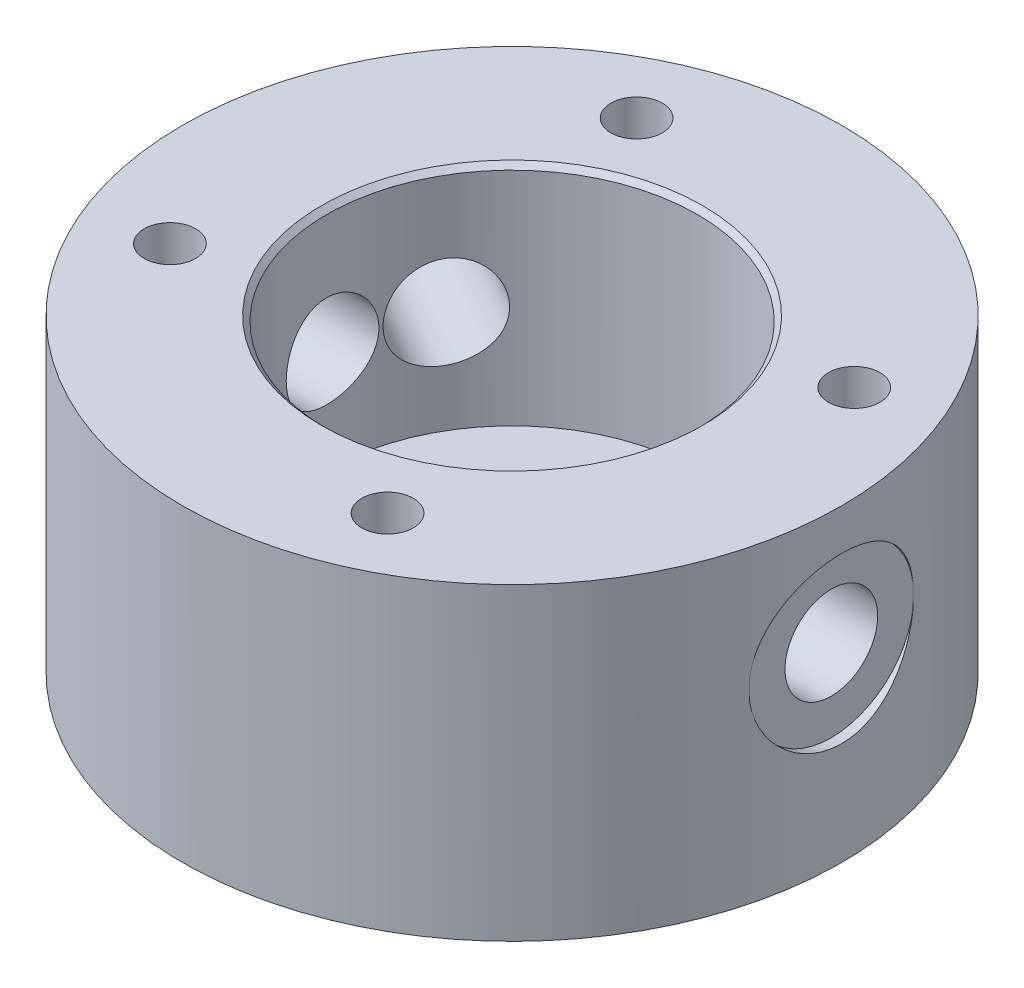
from build123d import *

# Parameters (mm, degrees)
ESBO_O4_W                        = 2.25
ESBO_O4_H                        = 16
F_4_5_4_5_DIAMETER_HOLE2_D       = 4.5
F_4_5_4_5_DIAMETER_HOLE2_DEPTH   = 18
F_4_5_4_5_DIAMETER_HOLE2_TIP     = 1.351936393
ESBO_O12_R                       = 16
ESBO_O12_R_2                     = 9
RESSALTO_EXTRUS_O1_DEPTH         = 1
CHANFRO1_SIZE                    = 0.5
CHANFRO2_SIZE                    = 0.25
FURO_DE_DI_METRO_4_5_4_5_2_D     = 4.5
FURO_DE_DI_METRO_4_5_4_5_2_DEPTH = 8
FURO_DE_DI_METRO_4_5_4_5_2_TIP   = 1.351936393
CORTE_EXTRUS_O4_START            = -0.5
ESBO_O18_R                       = 4
ESBO_O18_R_2                     = 2.25
CORTE_EXTRUS_O4_DEPTH            = 0.5
PADR_OCIRCULAR6_COUNT            = 2
PADR_OCIRCULAR6_ANGLE            = 30
PADR_OCIRCULAR7_COUNT            = 2
PADR_OCIRCULAR7_ANGLE            = 210


# Read off the part's stored shape, not the designer's step: PadrãoCircular5
with BuildPart() as part:
    # Esboço1 → Revolução1 (revolve)
    with BuildSketch(Plane.XY, mode=Mode.PRIVATE) as revolu_o1_sk:
        Polygon((3, -9), (16, -9), (16, 5), (9, 5), (9, -5), (3, -5), align=None)
    revolve(revolu_o1_sk.sketch.rotate(Axis((0, -9, 0), (0, 1, 0)), 90), axis=Axis((0, -9, 0), (0, 1, 0)))

    # Esboço4 → Furo de diâmetro Ø4.5 (4.5)1 (revolve, cut)
    with BuildSketch(Plane(origin=(16, 0, 0), x_dir=(0, 0, -1), z_dir=(0, 1, 0))):
        with Locations((1.125, 8)):
            Rectangle(ESBO_O4_W, ESBO_O4_H)
    revolve(axis=Axis((22.35, 0, 0), (-1, 0, 0)), mode=Mode.SUBTRACT)

    # Ø4.5 (4.5) Diameter Hole2
    with Locations(Plane(origin=(-13.856406461, 0, -8), x_dir=(0, -1, 0), z_dir=(-0.8660254037844364, 0, -0.5000000000000041))):
        with Locations((0, 0)):
            Hole(F_4_5_4_5_DIAMETER_HOLE2_D / 2, depth=F_4_5_4_5_DIAMETER_HOLE2_DEPTH)
            with Locations((0, 0, -(F_4_5_4_5_DIAMETER_HOLE2_DEPTH + F_4_5_4_5_DIAMETER_HOLE2_TIP / 2))):  # 118° drill point
                Cone(0, F_4_5_4_5_DIAMETER_HOLE2_D / 2, F_4_5_4_5_DIAMETER_HOLE2_TIP, mode=Mode.SUBTRACT)

    # Esboço12 → Ressalto-extrusão1 (add)
    with BuildSketch(Plane(origin=(0, 5, 0), x_dir=(1, 0, 0), z_dir=(0, 1, 0))):
        with Locations(Location((0, 0, 0), (0, 0, 90))):
            Circle(ESBO_O12_R)
        with Locations(Location((0, 0, 0), (0, 0, 90))):
            Circle(ESBO_O12_R_2, mode=Mode.SUBTRACT)
    extrude(amount=RESSALTO_EXTRUS_O1_DEPTH)

    # Esboço13 → Furo roscado de M3x0.51 (revolve, cut)
    with BuildSketch(Plane(origin=(11.328847338, 6, -5.282728272), x_dir=(0, 0, 1), z_dir=(1, 0, 0))):
        Polygon((0, 0), (0, 10.751075774), (1.25, 10), (1.25, 0), align=None)
    revolve(axis=Axis((11.328847338, 12.35, -5.282728272), (0, -1, 0)), mode=Mode.SUBTRACT)

    # PadrãoCircular5 outline → PadrãoCircular5 (revolve, cut)
    with BuildSketch(Plane(origin=(5.282728272, 0, 11.328847338), x_dir=(1, 0, 0), z_dir=(0, 0, 1))):
        Polygon((0, 6), (0, -4.751075774), (1.25, -4), (1.25, 6), align=None)
    revolve(axis=Axis((5.282728272, 0, 11.328847338), (0, 1, 0)), mode=Mode.SUBTRACT)

    # Padr_oCircular5 2 outline → Padr_oCircular5 2 (revolve, cut)
    with BuildSketch(Plane(origin=(-11.328847338, 0, 5.282728272), x_dir=(1, 0, 0), z_dir=(0, 0, 1))):
        Polygon((0, 6), (0, -4.751075774), (1.25, -4), (1.25, 6), align=None)
    revolve(axis=Axis((-11.328847338, 0, 5.282728272), (0, 1, 0)), mode=Mode.SUBTRACT)

    # Padr_oCircular5 3 outline → Padr_oCircular5 3 (revolve, cut)
    with BuildSketch(Plane(origin=(-5.282728272, 0, -11.328847338), x_dir=(1, 0, 0), z_dir=(0, 0, 1))):
        Polygon((0, 6), (0, -4.751075774), (1.25, -4), (1.25, 6), align=None)
    revolve(axis=Axis((-5.282728272, 0, -11.328847338), (0, 1, 0)), mode=Mode.SUBTRACT)

    # Chanfro1
    chanfro1_edges = [part.edges().sort_by_distance(p)[0] for p in [
        (0, -5, 3),
    ]]
    chamfer(chanfro1_edges, length=CHANFRO1_SIZE)

    # Chanfro2
    chanfro2_edges = [part.edges().sort_by_distance(p)[0] for p in [
        (0, 6, 9),
    ]]
    chamfer(chanfro2_edges, length=CHANFRO2_SIZE)

    # Furo de diâmetro Ø4.5 (4.5)2
    with Locations(Plane(origin=(-16, 0, 0), x_dir=(0, 0, -1), z_dir=(-1, 0, 0))):
        with Locations((0, 0)):
            Hole(FURO_DE_DI_METRO_4_5_4_5_2_D / 2, depth=FURO_DE_DI_METRO_4_5_4_5_2_DEPTH)
            with Locations((0, 0, -(FURO_DE_DI_METRO_4_5_4_5_2_DEPTH + FURO_DE_DI_METRO_4_5_4_5_2_TIP / 2))):  # 118° drill point
                Cone(0, FURO_DE_DI_METRO_4_5_4_5_2_D / 2, FURO_DE_DI_METRO_4_5_4_5_2_TIP, mode=Mode.SUBTRACT)

    # Esboço18 → Corte-extrusão4 (cut)
    with BuildSketch(Plane(origin=(-13.856406461, 0, -8), x_dir=(0, -1, 0), z_dir=(-0.8660254037844364, 0, -0.5000000000000041)).offset(CORTE_EXTRUS_O4_START)):
        Circle(ESBO_O18_R)
        with Locations(Location((0, 0, 0), (0, 0, 90))):
            Circle(ESBO_O18_R_2, mode=Mode.SUBTRACT)
    corte_extrus_o4 = extrude(amount=CORTE_EXTRUS_O4_DEPTH, mode=Mode.SUBTRACT)

    # PadrãoCircular6: Corte-extrusão4 ×2 about axis
    padr_ocircular6_axis = Axis((0, -9.75, 0), (0, 1, 0))
    for i in range(1, PADR_OCIRCULAR6_COUNT):
        add(corte_extrus_o4.rotate(padr_ocircular6_axis, i * PADR_OCIRCULAR6_ANGLE / (PADR_OCIRCULAR6_COUNT - 1)), mode=Mode.SUBTRACT)

    # PadrãoCircular7: Corte-extrusão4 ×2 about axis
    padr_ocircular7_axis = Axis((0, -9.75, 0), (0, 1, 0))
    for i in range(1, PADR_OCIRCULAR7_COUNT):
        add(corte_extrus_o4.rotate(padr_ocircular7_axis, i * PADR_OCIRCULAR7_ANGLE / (PADR_OCIRCULAR7_COUNT - 1)), mode=Mode.SUBTRACT)


solid = part.part
